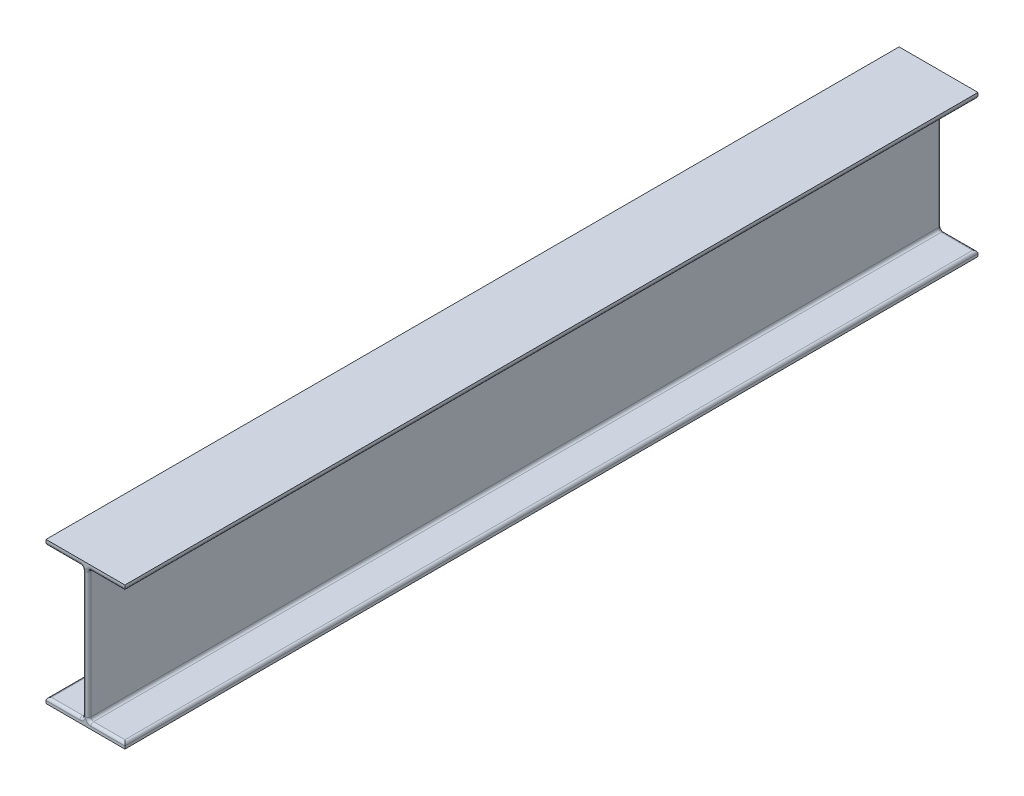
from build123d import *

# Parameters (mm, degrees)
BOSS_EXTRUDE1_DEPTH = 457.2
FILLET1_R           = 2.921


with BuildPart() as part:
    # Sketch1 → Boss-Extrude1 (new, symmetric)
    with BuildSketch(Plane.XY):
        Polygon((42.291, 152.4), (-42.291, 152.4), (-42.291, 146.558), (-2.921, 146.558), (-2.921, 5.842), (-42.291, 5.842), (-42.291, 0), (42.291, 0), (42.291, 5.842), (2.921, 5.842), (2.921, 146.558), (42.291, 146.558), align=None)
    extrude(amount=BOSS_EXTRUDE1_DEPTH, both=True)

    # Fillet1
    fillet1_edges = [part.edges().sort_by_distance(p)[0] for p in [
        (22.606, 146.558, -457.2),
        (2.921, 76.2, -457.2),
        (22.606, 5.842, -457.2),
        (-22.606, 146.558, 457.2),
        (-22.606, 5.842, -457.2),
        (-2.921, 76.2, -457.2),
        (-22.606, 146.558, -457.2),
        (-2.921, 76.2, 457.2),
        (-22.606, 5.842, 457.2),
        (42.291, 146.558, 0),
        (2.921, 146.558, 0),
        (2.921, 5.842, 0),
        (42.291, 5.842, 0),
        (-42.291, 5.842, 0),
        (-2.921, 5.842, 0),
        (-2.921, 146.558, 0),
        (-42.291, 146.558, 0),
        (22.606, 5.842, 457.2),
        (2.921, 76.2, 457.2),
        (22.606, 146.558, 457.2),
    ]]
    fillet(fillet1_edges, radius=FILLET1_R - 0.0001)  # a hair under: the kernel refuses the full size


solid = part.part
